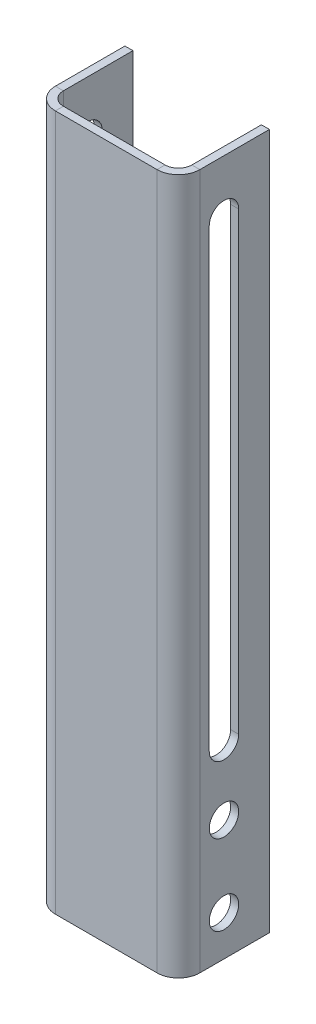
from build123d import *

# Parameters (mm, degrees)
SKETCH1_W                      = 54
SKETCH1_H                      = 260
BASE_FLANGE1_DEPTH             = 3
EDGE_FLANGE1_STRIP_W           = 22
EDGE_FLANGE1_STRIP_H           = 3
EDGE_FLANGE1_STRIP_CUT_DEPTH   = 260
EDGE_FLANGE1_STRIP_2_W         = 22
EDGE_FLANGE1_STRIP_2_H         = 3
EDGE_FLANGE1_STRIP_CUT_2_DEPTH = 260
EDGE_FLANGE1_DEPTH             = 260
EDGE_FLANGE1_BEND_DEPTH        = 260
CUT_EXTRUDE1_DEPTH             = 145.817126059
SKETCH20_R                     = 5.5
CUT_EXTRUDE2_DEPTH             = 145.817126059


# Sheet-metal steps are written as plain solids
with BuildPart() as part:
    # Sketch1 → Base-Flange1 (new body)
    with BuildSketch(Plane.XY):
        Rectangle(SKETCH1_W, SKETCH1_H)
    extrude(amount=-BASE_FLANGE1_DEPTH)

    # Edge-Flange1 strip (across the edge) → Edge-Flange1 strip cut (cut)
    with BuildSketch(Plane(origin=(27, 130, -3), x_dir=(-1, 0, 0), z_dir=(0, -1, 0))):
        with Locations((-3, -1.5)):
            Rectangle(EDGE_FLANGE1_STRIP_W, EDGE_FLANGE1_STRIP_H)
    extrude(amount=EDGE_FLANGE1_STRIP_CUT_DEPTH, mode=Mode.SUBTRACT)

    # Edge-Flange1 strip 2 (across the edge) → Edge-Flange1 strip cut 2 (cut)
    with BuildSketch(Plane(origin=(-27, -130, -3), x_dir=(1, 0, 0), z_dir=(0, 1, 0))):
        with Locations((-3, -1.5)):
            Rectangle(EDGE_FLANGE1_STRIP_2_W, EDGE_FLANGE1_STRIP_2_H)
    extrude(amount=EDGE_FLANGE1_STRIP_CUT_2_DEPTH, mode=Mode.SUBTRACT)

    # Edge-Flange1 section (across the edge) → Edge-Flange1 (add)
    with BuildSketch(Plane(origin=(27, 130, -3), x_dir=(-1, 0, 0), z_dir=(0, -1, 0))):
        with BuildLine():
            Line((0, 5), (0, 31))
            Line((0, 31), (3, 31))
            Line((3, 31), (3, 5))
            ThreePointArc((3, 5), (4.464466094, 1.464466094), (8, 0))
            Line((8, 0), (8, -3))
            ThreePointArc((8, -3), (2.343145751, -0.656854249), (0, 5))
        make_face()
    extrude(amount=EDGE_FLANGE1_DEPTH)

    # Edge-Flange1 section 2 (across the edge) → Edge-Flange1 bend (add)
    with BuildSketch(Plane(origin=(-27, -130, -3), x_dir=(1, 0, 0), z_dir=(0, 1, 0))):
        with BuildLine():
            Line((0, 5), (0, 31))
            Line((0, 31), (3, 31))
            Line((3, 31), (3, 5))
            ThreePointArc((3, 5), (4.464466094, 1.464466094), (8, 0))
            Line((8, 0), (8, -3))
            ThreePointArc((8, -3), (2.343145751, -0.656854249), (0, 5))
        make_face()
    extrude(amount=EDGE_FLANGE1_BEND_DEPTH)

    # Sketch18 → Cut-Extrude1 (cut, through all)
    with BuildSketch(Plane(origin=(27, 0, 0), x_dir=(0, 0, -1), z_dir=(1, 0, 0))):
        with BuildLine():
            Line((11.5, -60), (11.5, 110))
            ThreePointArc((11.5, 110), (17, 115.5), (22.5, 110))
            Line((22.5, 110), (22.5, -60))
            ThreePointArc((22.5, -60), (17, -65.5), (11.5, -60))
        make_face()
    extrude(amount=-CUT_EXTRUDE1_DEPTH, mode=Mode.SUBTRACT)

    # Sketch20 → Cut-Extrude2 (cut, through all)
    with BuildSketch(Plane(origin=(27, 0, 0), x_dir=(0, 0, -1), z_dir=(1, 0, 0))):
        with Locations((17, -115)):
            Circle(SKETCH20_R)
        with Locations((17, -85)):
            Circle(SKETCH20_R)
    extrude(amount=-CUT_EXTRUDE2_DEPTH, mode=Mode.SUBTRACT)


solid = part.part
